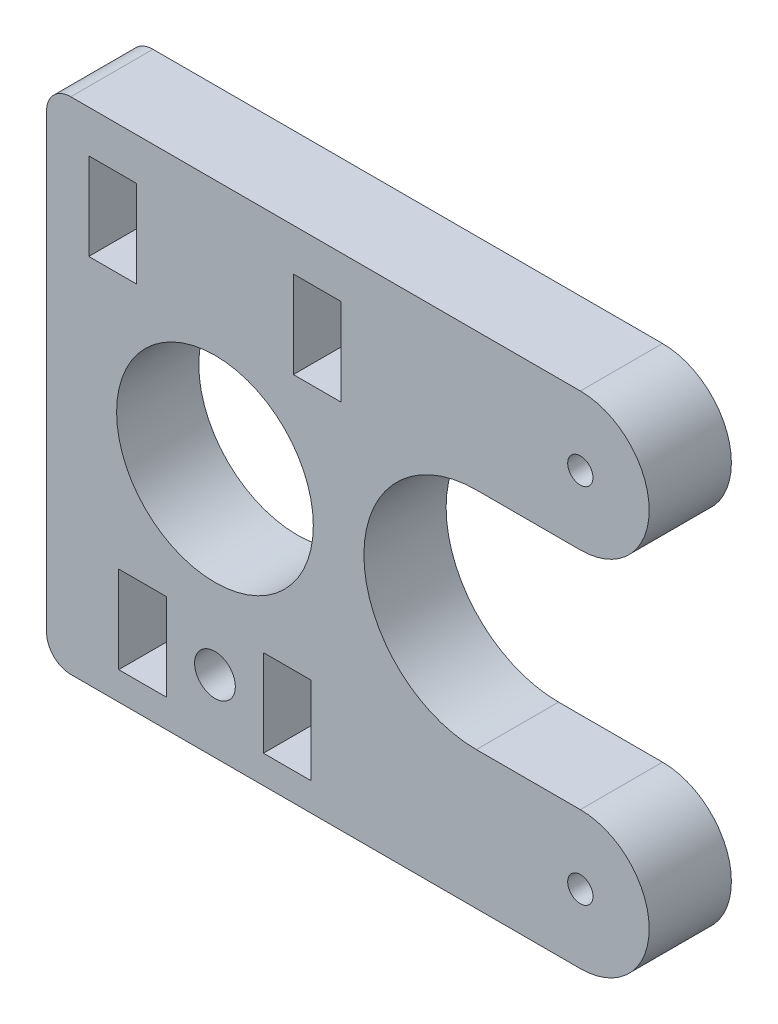
from build123d import *

# Parameters (mm, degrees)
SKETCH1_R           = 0.9
SKETCH1_R_2         = 1.45
SKETCH1_R_3         = 7
SKETCH1_W           = 3.400011
SKETCH1_H           = 6.2
SKETCH1_W_2         = 3.4
BOSS_EXTRUDE2_DEPTH = 5.85


with BuildPart() as part:
    # Sketch1 → Boss-Extrude2 (new body)
    with BuildSketch(Plane.XY):
        with BuildLine():
            Line((669.21684417, 348.56545661), (648.4638119, 348.56545661))
            ThreePointArc((648.4638119, 348.56545661), (647.249496344, 348.062470637), (646.746510371, 346.848155081))
            Line((646.746510371, 346.848155081), (646.746510371, 314.682758138))
            ThreePointArc((646.746510371, 314.682758138), (647.249496344, 313.468442582), (648.4638119, 312.96545661))
            Line((648.4638119, 312.96545661), (669.21684417, 312.96545661))
            Line((669.21684417, 312.96545661), (684.726521371, 312.96545661))
            ThreePointArc((684.726521371, 312.96545661), (689.626521371, 317.86545661), (684.726521371, 322.76545661))
            Line((684.726521371, 322.76545661), (677.326521371, 322.76545661))
            ThreePointArc((677.326521371, 322.76545661), (669.326521371, 330.76545661), (677.326521371, 338.76545661))
            Line((677.326521371, 338.76545661), (684.726521371, 338.76545661))
            ThreePointArc((684.726521371, 338.76545661), (689.626521371, 343.66545661), (684.726521371, 348.56545661))
            Line((684.726521371, 348.56545661), (669.21684417, 348.56545661))
        make_face()
        with Locations((684.726521371, 343.66545661)):
            Circle(SKETCH1_R, mode=Mode.SUBTRACT)
        with Locations((684.726521371, 317.86545661)):
            Circle(SKETCH1_R, mode=Mode.SUBTRACT)
        with Locations((658.726521371, 318.06545661)):
            Circle(SKETCH1_R_2, mode=Mode.SUBTRACT)
        with Locations((658.726521371, 330.76545661)):
            Circle(SKETCH1_R_3, mode=Mode.SUBTRACT)
        with Locations((651.446515871, 342.46545661)):
            Rectangle(SKETCH1_W, SKETCH1_H, mode=Mode.SUBTRACT)
        with Locations((653.576521371, 318.06545661)):
            Rectangle(SKETCH1_W_2, SKETCH1_H, mode=Mode.SUBTRACT)
        with Locations((666.006526871, 342.46545661)):
            Rectangle(SKETCH1_W, SKETCH1_H, mode=Mode.SUBTRACT)
        with Locations((663.876521371, 318.06545661)):
            Rectangle(SKETCH1_W_2, SKETCH1_H, mode=Mode.SUBTRACT)
    extrude(amount=BOSS_EXTRUDE2_DEPTH)


solid = part.part
